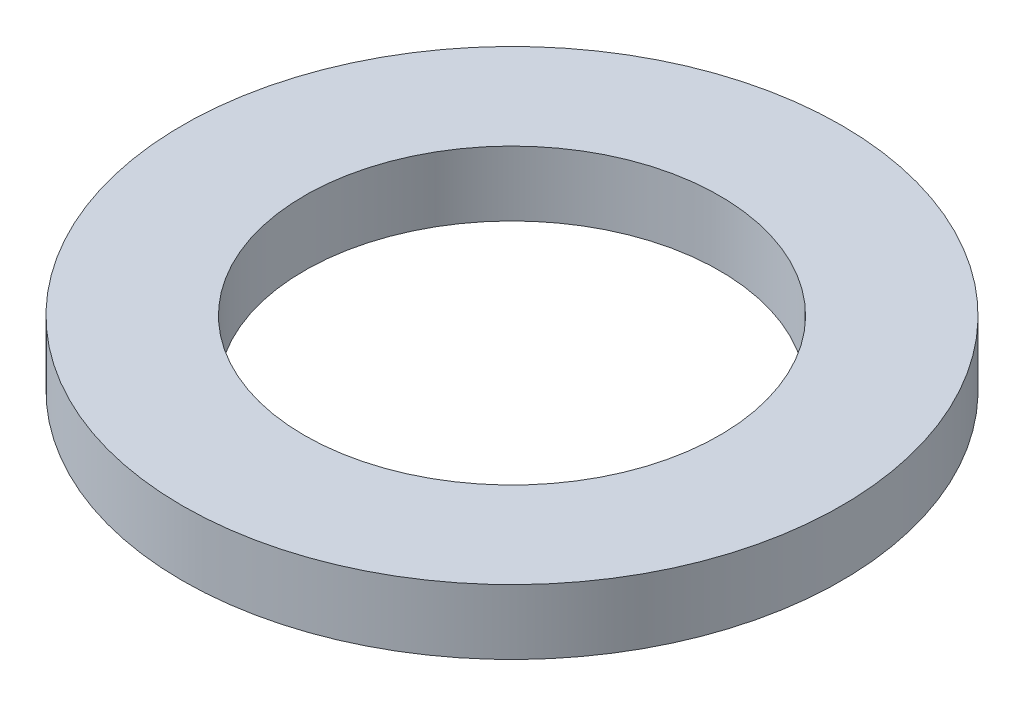
from build123d import *

# Parameters (mm, degrees)
SKETCH1_R           = 25.4
BOSS_EXTRUDE1_DEPTH = 5
SKETCH2_R           = 16
CUT_EXTRUDE1_DEPTH  = 5


with BuildPart() as part:
    # Sketch1 → Boss-Extrude1 (new body)
    with BuildSketch(Plane(origin=(0, 0, 0), x_dir=(1, 0, 0), z_dir=(0, 1, 0))):
        Circle(SKETCH1_R)
    extrude(amount=BOSS_EXTRUDE1_DEPTH)

    # Sketch2 → Cut-Extrude1 (cut)
    with BuildSketch(Plane(origin=(0, 5, 0), x_dir=(1, 0, 0), z_dir=(0, 1, 0))):
        Circle(SKETCH2_R)
    extrude(amount=-CUT_EXTRUDE1_DEPTH, mode=Mode.SUBTRACT)


solid = part.part
